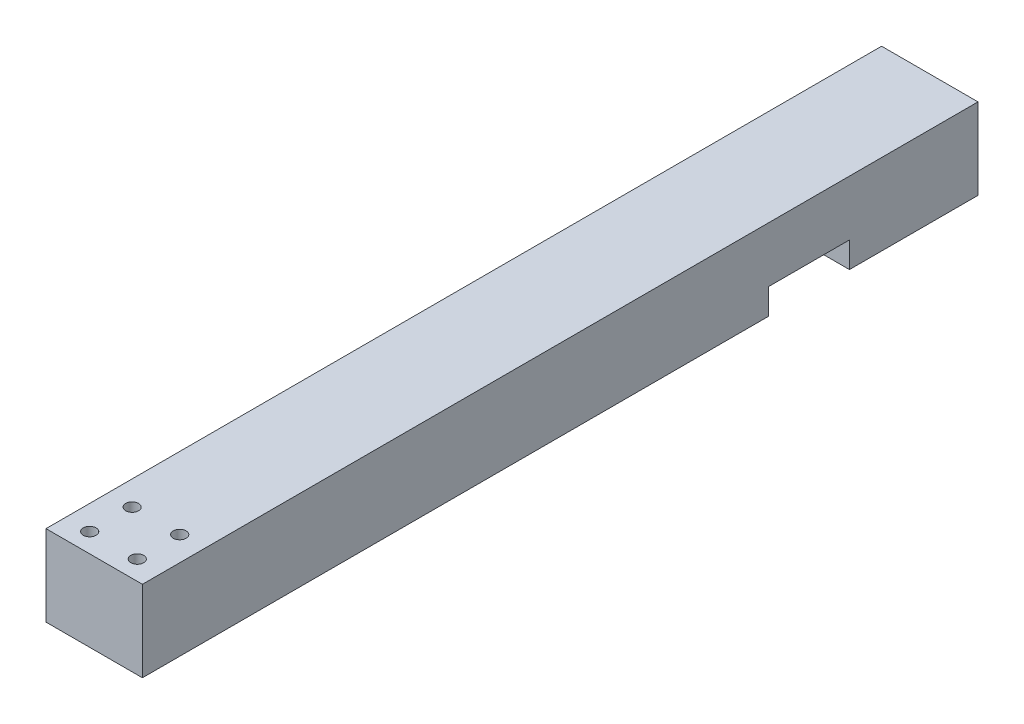
from build123d import *

# Parameters (mm, degrees)
ESQUISSE1_W             = 75
ESQUISSE1_H             = 63
BOSS_EXTRU_1_DEPTH      = 650
ESQUISSE2_R             = 5
ENL_V_MAT_EXTRU_1_DEPTH = 658.338573339
ESQUISSE3_W             = 75
ESQUISSE3_H             = 63
ENL_V_MAT_EXTRU_2_DEPTH = 20


with BuildPart() as part:
    # Esquisse1 → Boss.-Extru.1 (new body)
    with BuildSketch(Plane.XY):
        with Locations((37.5, 31.5)):
            Rectangle(ESQUISSE1_W, ESQUISSE1_H)
    extrude(amount=BOSS_EXTRU_1_DEPTH)

    # Esquisse2 → Enlèv. mat.-Extru.1 (cut, through all)
    with BuildSketch(Plane.XZ):
        with Locations((19, 602)):
            Circle(ESQUISSE2_R)
        with Locations((19, 635)):
            Circle(ESQUISSE2_R)
        with Locations((56, 635)):
            Circle(ESQUISSE2_R)
        with Locations((56, 602)):
            Circle(ESQUISSE2_R)
    extrude(amount=-ENL_V_MAT_EXTRU_1_DEPTH, mode=Mode.SUBTRACT)

    # Esquisse3 → Enlèv. mat.-Extru.2 (cut)
    with BuildSketch(Plane.XZ):
        with Locations((37.5, 131.5)):
            Rectangle(ESQUISSE3_W, ESQUISSE3_H)
    extrude(amount=-ENL_V_MAT_EXTRU_2_DEPTH, mode=Mode.SUBTRACT)


solid = part.part
